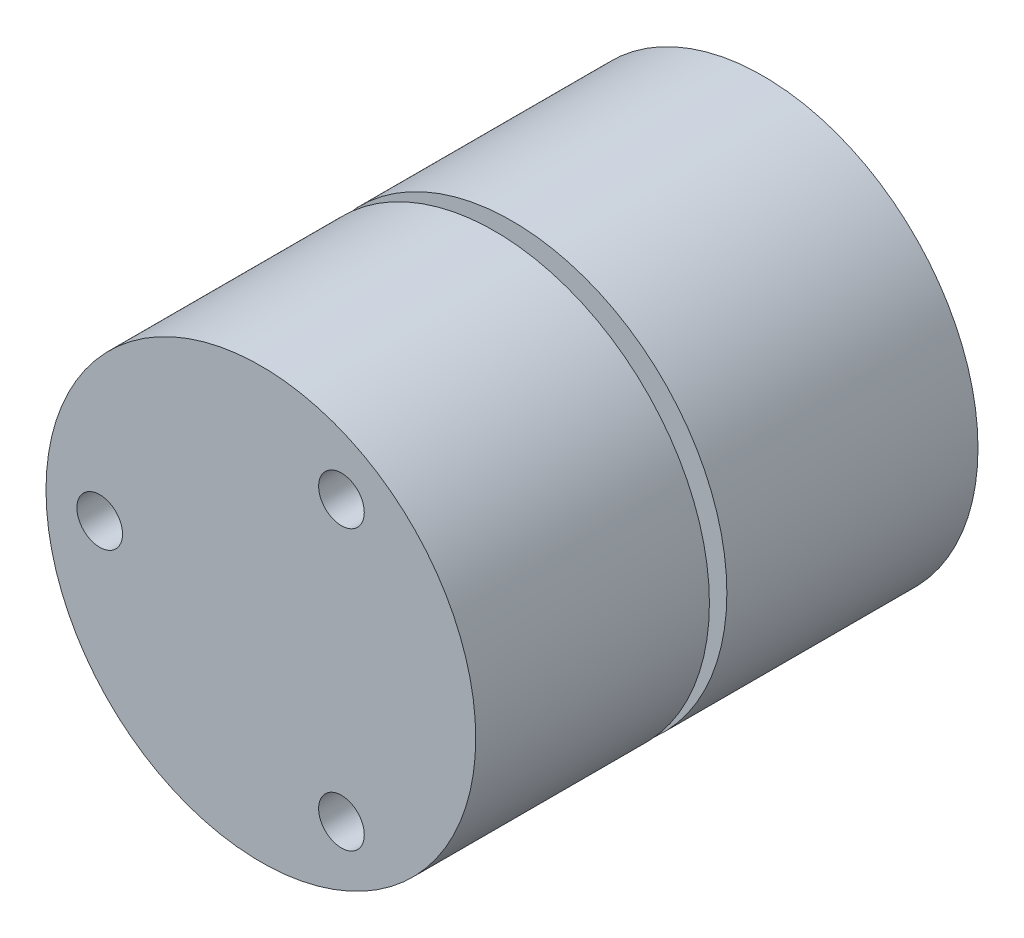
from build123d import *

# Parameters (mm, degrees)
SKETCH_1_R          = 8
EXTRUDE_1_DEPTH     = 18.7
SKETCH_2_W          = 4
SKETCH_2_H          = 6
CUT_EXTRUDE_1_DEPTH = 18.7
OTHER_START         = 9.35
OTHER_4_OUTLINE_R   = 8
OTHER_4_OUTLINE_R_2 = 4.714576893
OTHER_4_DEPTH       = 0.65
SKETCH_1_3_R        = 0.85
CUT_EXTRUDE_2_DEPTH = 2
CUT_EXTRUDE_START   = 16.7
SKETCH_1_4_R        = 0.85
CUT_EXTRUDE_3_DEPTH = 2
SKETCH_1_6_R        = 0.85
CUT_EXTRUDE_4_DEPTH = 2
SKETCH_1_7_R        = 0.85
CUT_EXTRUDE_5_DEPTH = 2


# Read off the part's stored shape, not the designer's step: 切除-旋转-薄壁4
with BuildPart() as part:
    # 草图1 → 凸台-拉伸1 (new body)
    with BuildSketch(Plane.XY):
        Circle(SKETCH_1_R)
    extrude(amount=EXTRUDE_1_DEPTH)

    # 草图2 → 切除-拉伸1 (cut)
    with BuildSketch(Plane(origin=(0, 0, 0), x_dir=(0, 0, -1), z_dir=(1, 0, 0))):
        with Locations((-13.9, 0)):
            Rectangle(SKETCH_2_W, SKETCH_2_H)
    extrude(amount=-CUT_EXTRUDE_1_DEPTH, mode=Mode.SUBTRACT)

    # 切除-旋转-薄壁4 outline → 切除-旋转-薄壁4 (cut)
    with BuildSketch(Plane.XY.offset(OTHER_START)):
        Circle(OTHER_4_OUTLINE_R)
        Circle(OTHER_4_OUTLINE_R_2, mode=Mode.SUBTRACT)
    extrude(amount=OTHER_4_DEPTH, mode=Mode.SUBTRACT)

    # 草图1<3> → 切除-拉伸2 (cut)
    with BuildSketch(Plane.XY):
        with Locations((-6, 0)):
            Circle(SKETCH_1_3_R)
        with Locations((3, 5.196152423)):
            Circle(SKETCH_1_3_R)
    extrude(amount=CUT_EXTRUDE_2_DEPTH, mode=Mode.SUBTRACT)

    # 草图1<4> → 切除-拉伸3 (cut)
    with BuildSketch(Plane.XY.offset(CUT_EXTRUDE_START)):
        with Locations((-6, 0)):
            Circle(SKETCH_1_4_R)
        with Locations((3, 5.196152423)):
            Circle(SKETCH_1_4_R)
    extrude(amount=CUT_EXTRUDE_3_DEPTH, mode=Mode.SUBTRACT)

    # 草图1<6> → 切除-拉伸4 (cut)
    with BuildSketch(Plane.XY):
        with Locations(Location((3, -5.196152423, 0), (0, 0, 180))):
            Circle(SKETCH_1_6_R)
    extrude(amount=CUT_EXTRUDE_4_DEPTH, mode=Mode.SUBTRACT)

    # 草图1<7> → 切除-拉伸5 (cut)
    with BuildSketch(Plane.XY.offset(CUT_EXTRUDE_START)):
        with Locations(Location((3, -5.196152423, 0), (0, 0, 180))):
            Circle(SKETCH_1_7_R)
    extrude(amount=CUT_EXTRUDE_5_DEPTH, mode=Mode.SUBTRACT)


solid = part.part
